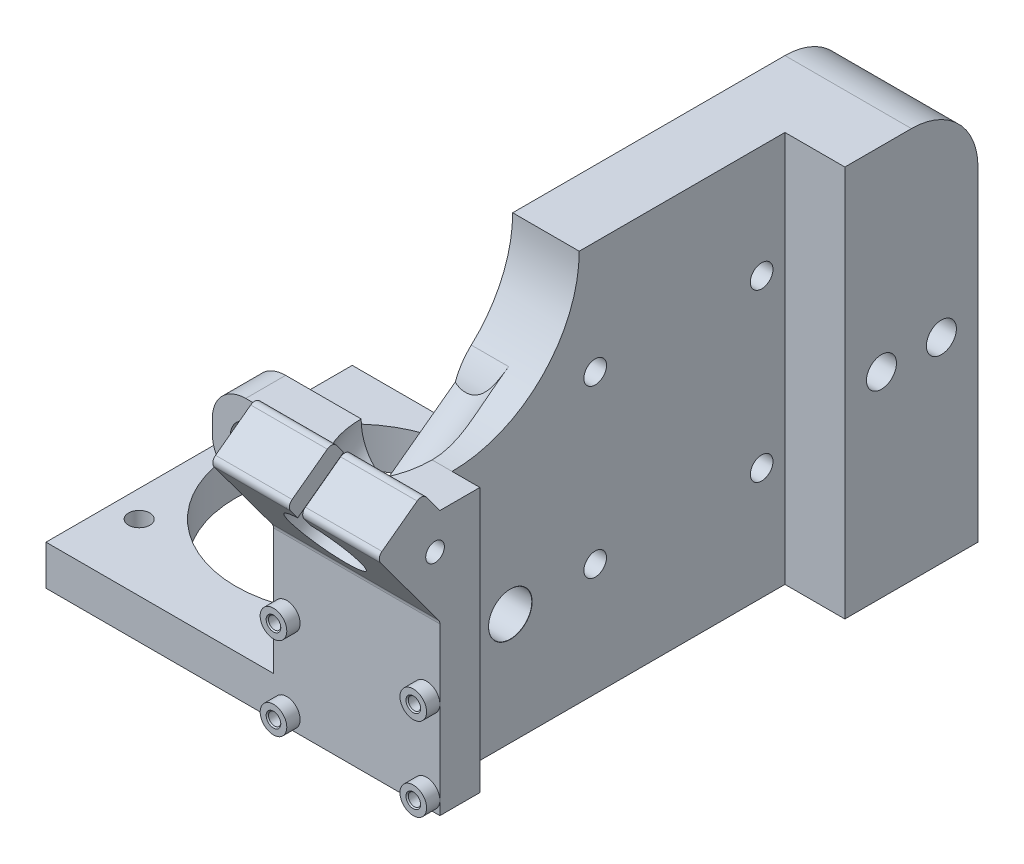
from build123d import *

# Parameters (mm, degrees)
SKETCH2_W                       = 37
SKETCH2_H                       = 12.2
SKETCH2_R                       = 1.5
BOSS_EXTRUDE2_DEPTH             = 6
CBORE_FOR_M3_SHCS1_D            = 3.4
CBORE_FOR_M3_SHCS1_CBORE_D      = 6.5
CBORE_FOR_M3_SHCS1_CBORE_DEPTH  = 3
SKETCH21_W                      = 6
SKETCH21_H                      = 21.5
BOSS_EXTRUDE6_DEPTH             = 6
SKETCH22_W                      = 40
SKETCH22_H                      = 6
BOSS_EXTRUDE7_DEPTH             = 6
SKETCH23_W                      = 25
SKETCH23_H                      = 39.7
BOSS_EXTRUDE8_DEPTH             = 6
SKETCH24_W                      = 40
SKETCH24_H                      = 40
SKETCH24_R                      = 1.6
BOSS_EXTRUDE9_DEPTH             = 6
CUT_EXTRUDE9_REACH              = 71.499
SKETCH25_R                      = 17.5
SKETCH26_R                      = 2
BOSS_EXTRUDE10_DEPTH            = 2
M2X0_4_TAPPED_HOLE1_D           = 1.85
M2X0_4_TAPPED_HOLE1_DEPTH       = 8
M2X0_4_TAPPED_HOLE1_CSINK_D     = 2.2
M2X0_4_TAPPED_HOLE1_CSINK_ANGLE = 90
M2X0_4_TAPPED_HOLE1_TIP         = 0.555796073
BOSS_EXTRUDE12_DEPTH            = 25
FILLET1_R                       = 1
BOSS_EXTRUDE16_REACH            = 78.287
SKETCH45_W                      = 5
SKETCH45_H                      = 6
SKETCH46_W                      = 10
SKETCH46_H                      = 32.7
BOSS_EXTRUDE20_DEPTH            = 50
BOSS_EXTRUDE22_DEPTH            = 10
SKETCH53_W                      = 20
SKETCH53_H                      = 58.8
BOSS_EXTRUDE23_DEPTH            = 19
SKETCH54_R                      = 2.25
CUT_EXTRUDE14_DEPTH             = 20
CUT_EXTRUDE16_DEPTH             = 11
SKETCH36_R                      = 5.334
CUT_EXTRUDE10_DEPTH             = 18.668
CUT_EXTRUDE12_REACH             = 99.622
CUT_EXTRUDE12_END_RADIUS        = 5.334
SKETCH38_R                      = 1.4
SKETCH69_W                      = 12
SKETCH69_H                      = 30
BOSS_EXTRUDE24_DEPTH            = 6
CBORE_FOR_M3_SHCS3_D            = 3.4
CBORE_FOR_M3_SHCS3_DEPTH        = 12
CBORE_FOR_M3_SHCS3_CBORE_D      = 6.5
CBORE_FOR_M3_SHCS3_CBORE_DEPTH  = 3
CBORE_FOR_M3_SHCS3_TIP          = 1.021463052
FILLET7_R                       = 10
M2X0_4_TAPPED_HOLE2_D           = 1.85
M2X0_4_TAPPED_HOLE2_DEPTH       = 7.2
M2X0_4_TAPPED_HOLE2_CSINK_D     = 2.2
M2X0_4_TAPPED_HOLE2_CSINK_ANGLE = 90
M2X0_4_TAPPED_HOLE2_TIP         = 0.555796073
CUT_EXTRUDE17_DEPTH             = 10
FILLET9_R                       = 9
SKETCH67_W                      = 25
SKETCH67_H                      = 33.7
CUT_EXTRUDE18_DEPTH             = 10
FILLET10_R                      = 5


with BuildPart() as part:
    # Sketch2 → Boss-Extrude2 (new body)
    with BuildSketch(Plane.XY):
        Rectangle(SKETCH2_W, SKETCH2_H)
        with Locations((12.42, 0)):
            Circle(SKETCH2_R, mode=Mode.SUBTRACT)
    extrude(amount=BOSS_EXTRUDE2_DEPTH)

    # CBORE for M3 SHCS1 (through all)
    with Locations(Plane.XY.offset(6)):
        with Locations((12.42, 0)):
            CounterBoreHole(CBORE_FOR_M3_SHCS1_D / 2, CBORE_FOR_M3_SHCS1_CBORE_D / 2, CBORE_FOR_M3_SHCS1_CBORE_DEPTH)

    # Sketch21 → Boss-Extrude6 (add)
    with BuildSketch(Plane.XY.offset(6)):
        with Locations((-15.5, -16.85)):
            Rectangle(SKETCH21_W, SKETCH21_H)
    extrude(amount=-BOSS_EXTRUDE6_DEPTH)

    # Sketch22 → Boss-Extrude7 (add)
    with BuildSketch(Plane.XY.offset(6)):
        with Locations((1.5, -30.6)):
            Rectangle(SKETCH22_W, SKETCH22_H)
    extrude(amount=-BOSS_EXTRUDE7_DEPTH)

    # Sketch23 → Boss-Extrude8 (add)
    with BuildSketch(Plane.XY.offset(6)):
        with Locations((28.17, -13.75)):
            Rectangle(SKETCH23_W, SKETCH23_H)
    extrude(amount=-BOSS_EXTRUDE8_DEPTH)

    # Sketch24 → Boss-Extrude9 (add)
    with BuildSketch(Plane.XZ.offset(27.6)):
        with Locations((1.5, -20)):
            Rectangle(SKETCH24_W, SKETCH24_H)
        with Locations(Location((17.5, -4, 0), (0, 0, 270))):
            Circle(SKETCH24_R, mode=Mode.SUBTRACT)
        with Locations(Location((-14.5, -4, 0), (0, 0, 270))):
            Circle(SKETCH24_R, mode=Mode.SUBTRACT)
        with Locations(Location((17.5, -36, 0), (0, 0, 270))):
            Circle(SKETCH24_R, mode=Mode.SUBTRACT)
    extrude(amount=BOSS_EXTRUDE9_DEPTH)

    # Sketch25 → Cut-Extrude9 (cut, up to next)
    with BuildSketch(Plane.XZ.offset(33.6), mode=Mode.PRIVATE) as cut_extrude9_sk1:
        with Locations(Location((1.5, -20, 0), (0, 0, 270))):
            Circle(SKETCH25_R)
    cut_extrude9_tool1 = extrude(cut_extrude9_sk1.sketch, amount=-CUT_EXTRUDE9_REACH, mode=Mode.PRIVATE) & part.part
    add(cut_extrude9_tool1.solids().sort_by_distance((1.5, -33.6, -20))[0], mode=Mode.SUBTRACT)

    # Sketch26 → Boss-Extrude10 (add)
    with BuildSketch(Plane.XY.offset(6)):
        with Locations((38.67, -31.6)):
            Circle(SKETCH26_R)
        with Locations(Location((17.67, -31.6, 0), (0, 0, 270))):
            Circle(SKETCH26_R)
        with Locations(Location((17.67, -19.1, 0), (0, 0, 180))):
            Circle(SKETCH26_R)
        with Locations((38.67, -19.1)):
            Circle(SKETCH26_R)
    extrude(amount=BOSS_EXTRUDE10_DEPTH)

    # M2x0.4 Tapped Hole1
    with Locations(Plane.XY.offset(8)):
        with Locations((17.67, -31.6), (17.67, -19.1), (38.67, -19.1), (38.67, -31.6)):
            CounterSinkHole(M2X0_4_TAPPED_HOLE1_D / 2, M2X0_4_TAPPED_HOLE1_CSINK_D / 2, depth=M2X0_4_TAPPED_HOLE1_DEPTH, counter_sink_angle=M2X0_4_TAPPED_HOLE1_CSINK_ANGLE)
            with Locations((0, 0, -(M2X0_4_TAPPED_HOLE1_DEPTH + M2X0_4_TAPPED_HOLE1_TIP / 2))):  # 118° drill point
                Cone(0, M2X0_4_TAPPED_HOLE1_D / 2, M2X0_4_TAPPED_HOLE1_TIP, mode=Mode.SUBTRACT)

    # Sketch35 → Boss-Extrude12 (add)
    with BuildSketch(Plane(origin=(40.67, 0, 0), x_dir=(0, 0, -1), z_dir=(1, 0, 0))):
        Polygon((-6, -8.331204337), (-15.505292411, 4.539281908), (-8.60888282, 9.632515256), (-6, 6.1), align=None)
    extrude(amount=-BOSS_EXTRUDE12_DEPTH)

    # Fillet1
    fillet1_edges = [part.edges().sort_by_distance(p)[0] for p in [
        (28.17, -8.331204337, 6),
        (28.17, 4.539281908, 15.505292411),
        (28.17, 9.632515256, 8.60888282),
    ]]
    fillet(fillet1_edges, radius=FILLET1_R)

    # Sketch45 → Boss-Extrude16 (add, up to next)
    with BuildSketch(Plane(origin=(0, 0, -40), x_dir=(-1, 0, 0), z_dir=(0, 0, -1)), mode=Mode.PRIVATE) as boss_extrude16_sk1:
        with Locations((-24, -30.6)):
            Rectangle(SKETCH45_W, SKETCH45_H)
    boss_extrude16_tool1 = extrude(boss_extrude16_sk1.sketch, amount=-BOSS_EXTRUDE16_REACH, mode=Mode.PRIVATE) - part.part
    add(boss_extrude16_tool1.solids().sort_by_distance((24, -30.6, -40))[0])

    # Sketch46 → Boss-Extrude20 (add)
    with BuildSketch(Plane(origin=(0, 0, 0), x_dir=(-1, 0, 0), z_dir=(0, 0, -1))):
        with Locations((-31.5, -17.25)):
            Rectangle(SKETCH46_W, SKETCH46_H)
    extrude(amount=BOSS_EXTRUDE20_DEPTH)

    # Sketch48 → Boss-Extrude22 (add)
    with BuildSketch(Plane(origin=(36.5, 0, 0), x_dir=(0, 0, -1), z_dir=(1, 0, 0))):
        with BuildLine():
            Line((50, -0.9), (0, -0.9))
            Line((0, -0.9), (0, 6.1))
            ThreePointArc((0, 6.1), (13.505739521, 11.694260479), (19.1, 25.2))
            Line((19.1, 25.2), (50, 25.2))
            Line((50, 25.2), (50, -0.9))
        make_face()
    extrude(amount=-BOSS_EXTRUDE22_DEPTH)

    # Sketch53 → Boss-Extrude23 (add)
    with BuildSketch(Plane.ZY.offset(-26.5)):
        with Locations((-60, -4.2)):
            Rectangle(SKETCH53_W, SKETCH53_H)
    extrude(amount=-BOSS_EXTRUDE23_DEPTH)

    # Sketch54 → Cut-Extrude14 (cut)
    with BuildSketch(Plane(origin=(45.5, 0, 0), x_dir=(0, 0, -1), z_dir=(1, 0, 0))):
        with Locations((64.5, -4.2)):
            Circle(SKETCH54_R)
        with Locations((55.5, -4.2)):
            Circle(SKETCH54_R)
    extrude(amount=-CUT_EXTRUDE14_DEPTH, mode=Mode.SUBTRACT)

    # Sketch56 → Cut-Extrude16 (cut)
    with BuildSketch(Plane.ZY.offset(-26.5)):
        Polygon((-66.520725942, -0.7), (-68.541451884, -4.2), (-66.520725942, -7.7), (-62.479274058, -7.7), (-60.458548116, -4.2), (-62.479274058, -0.7), align=None)
        Polygon((-57.520725942, -0.7), (-59.541451884, -4.2), (-57.520725942, -7.7), (-53.479274058, -7.7), (-51.458548116, -4.2), (-53.479274058, -0.7), align=None)
    extrude(amount=-CUT_EXTRUDE16_DEPTH, mode=Mode.SUBTRACT)

    # Sketch36 → Cut-Extrude10 (cut)
    with BuildSketch(Plane(origin=(0, -5.807639013, 7.863738935), x_dir=(1, 0, 0), z_dir=(0, -0.5940807757059963, 0.804405390295566))):
        with Locations(Location((28.17, 4.862818978, 0), (0, 0, 270))):
            Circle(SKETCH36_R)
    extrude(amount=-CUT_EXTRUDE10_DEPTH, mode=Mode.SUBTRACT)

    # Cut-Extrude12: up to this cylinder (the profile starts outside it)
    cut_extrude12_end = Plane(origin=(28.17, 1.074442904, 6.730618929), z_dir=(0, -0.5940807757059963, 0.8044053902955659)) * Cylinder(CUT_EXTRUDE12_END_RADIUS, 210.912, mode=Mode.PRIVATE)
    # Sketch38 → Cut-Extrude12 (cut, up to the surface)
    with BuildSketch(Plane(origin=(40.67, 0, 0), x_dir=(0, 0, -1), z_dir=(1, 0, 0)), mode=Mode.PRIVATE) as cut_extrude12_sk1:
        with Locations(Location((-6.730619254, 1.074442664, 0), (0, 0, 90))):
            Circle(SKETCH38_R)
    cut_extrude12_tool1 = extrude(cut_extrude12_sk1.sketch, amount=-CUT_EXTRUDE12_REACH, mode=Mode.PRIVATE) - cut_extrude12_end
    add(cut_extrude12_tool1.solids().sort_by_distance((40.67, 1.074443, 6.730619))[0], mode=Mode.SUBTRACT)

    # Sketch69 → Boss-Extrude24 (add)
    with BuildSketch(Plane.XZ.offset(33.6)):
        with Locations((20.5, -55)):
            Rectangle(SKETCH69_W, SKETCH69_H)
    extrude(amount=-BOSS_EXTRUDE24_DEPTH)

    # CBORE for M3 SHCS3
    with Locations(Plane.ZY.offset(-26.5)):
        with Locations((-46.5, -16.7), (-46.5, 8.3), (-21.5, 8.3), (-21.5, -16.7)):
            CounterBoreHole(CBORE_FOR_M3_SHCS3_D / 2, CBORE_FOR_M3_SHCS3_CBORE_D / 2, CBORE_FOR_M3_SHCS3_CBORE_DEPTH, depth=CBORE_FOR_M3_SHCS3_DEPTH)
            with Locations((0, 0, -(CBORE_FOR_M3_SHCS3_DEPTH + CBORE_FOR_M3_SHCS3_TIP / 2))):  # 118° drill point
                Cone(0, CBORE_FOR_M3_SHCS3_D / 2, CBORE_FOR_M3_SHCS3_TIP, mode=Mode.SUBTRACT)

    # Fillet7
    fillet7_edges = [part.edges().sort_by_distance(p)[0] for p in [
        (36, 25.2, -70),
        (14.5, -30.6, -40),
    ]]
    fillet(fillet7_edges, radius=FILLET7_R)

    # M2x0.4 Tapped Hole2
    with Locations(Plane(origin=(-7.1, -33.6, 0), x_dir=(0, 0, 1), z_dir=(0, -1, 0))):
        with Locations((-68, -24.52), (-68, -46.02), (-55.3, -46.02), (-55.3, -24.52)):
            CounterSinkHole(M2X0_4_TAPPED_HOLE2_D / 2, M2X0_4_TAPPED_HOLE2_CSINK_D / 2, depth=M2X0_4_TAPPED_HOLE2_DEPTH, counter_sink_angle=M2X0_4_TAPPED_HOLE2_CSINK_ANGLE)
            with Locations((0, 0, -(M2X0_4_TAPPED_HOLE2_DEPTH + M2X0_4_TAPPED_HOLE2_TIP / 2))):  # 118° drill point
                Cone(0, M2X0_4_TAPPED_HOLE2_D / 2, M2X0_4_TAPPED_HOLE2_TIP, mode=Mode.SUBTRACT)

    # Sketch65 → CBORE for M3 SHCS4 (revolve, cut)
    with BuildSketch(Plane(origin=(36.5, -16.85, -8.75), x_dir=(0, 0, -1), z_dir=(0, 1, 0))):
        Polygon((0, 0), (0, 55), (1.7, 55), (1.7, 5), (3.25, 5), (3.25, 0.025), (3.275, 0), align=None)
    revolve(axis=Axis((42.85, -16.85, -8.75), (-1, 0, 0)), mode=Mode.SUBTRACT)

    # Sketch66 → Cut-Extrude17 (cut)
    with BuildSketch(Plane(origin=(0, -0.714405664, 0.967329344), x_dir=(-1, 0, 0), z_dir=(0, 0.5940807757059955, -0.8044053902955667))):
        with BuildLine():
            Line((-27.17, 4.862818978), (-27.17, 18.862818978))
            ThreePointArc((-27.17, 18.862818978), (-28.17, 19.862818978), (-29.17, 18.862818978))
            Line((-29.17, 18.862818978), (-29.17, 4.862818978))
            ThreePointArc((-29.17, 4.862818978), (-28.17, 3.862818978), (-27.17, 4.862818978))
        make_face()
    extrude(amount=-CUT_EXTRUDE17_DEPTH, mode=Mode.SUBTRACT)

    # Fillet9
    # the kernel refuses this fillet: 9 mm, written as the material it takes off along each edge
    with BuildSketch(Plane(origin=(1.897904454, 7.023490289, -5.867239107), x_dir=(0, 0.5022969559186404, -0.8646951879563499), z_dir=(1, 0, 0))) as fillet9_piece_1_section:
        with BuildLine():
            CenterArc((10.024766174, -8.794666566), FILLET9_R, 102.262397273, 84.032651027)
            Line((1.079032255, -9.781502248), (0, 0))
            ThreePointArc((0, 0), (4.056632074, -0.435763176), (8.113264149, 0))
        make_face()
    fillet9_piece_1 = extrude(amount=55.475123288, mode=Mode.PRIVATE)
    fillet9_piece_1 = fillet9_piece_1 & Plane(origin=(28.17, 10.730975601, -6.34465176), x_dir=(0, -0.804405390295566, -0.5940807757059963), z_dir=(0, -0.5940807757059963, 0.804405390295566)) * Cylinder(5.334, 151, mode=Mode.PRIVATE)
    add(fillet9_piece_1, mode=Mode.SUBTRACT)

    # Sketch67 → Cut-Extrude18 (cut)
    with BuildSketch(Plane(origin=(0, 0, 0), x_dir=(-1, 0, 0), z_dir=(0, 0, -1))):
        with Locations((6, -10.75)):
            Rectangle(SKETCH67_W, SKETCH67_H)
    extrude(amount=-CUT_EXTRUDE18_DEPTH, mode=Mode.SUBTRACT)

    # Fillet10
    fillet10_edges = [part.edges().sort_by_distance(p)[0] for p in [
        (6.5, -6.1, 3),
        (6.5, 6.1, 3),
    ]]
    fillet(fillet10_edges, radius=FILLET10_R)


solid = part.part
